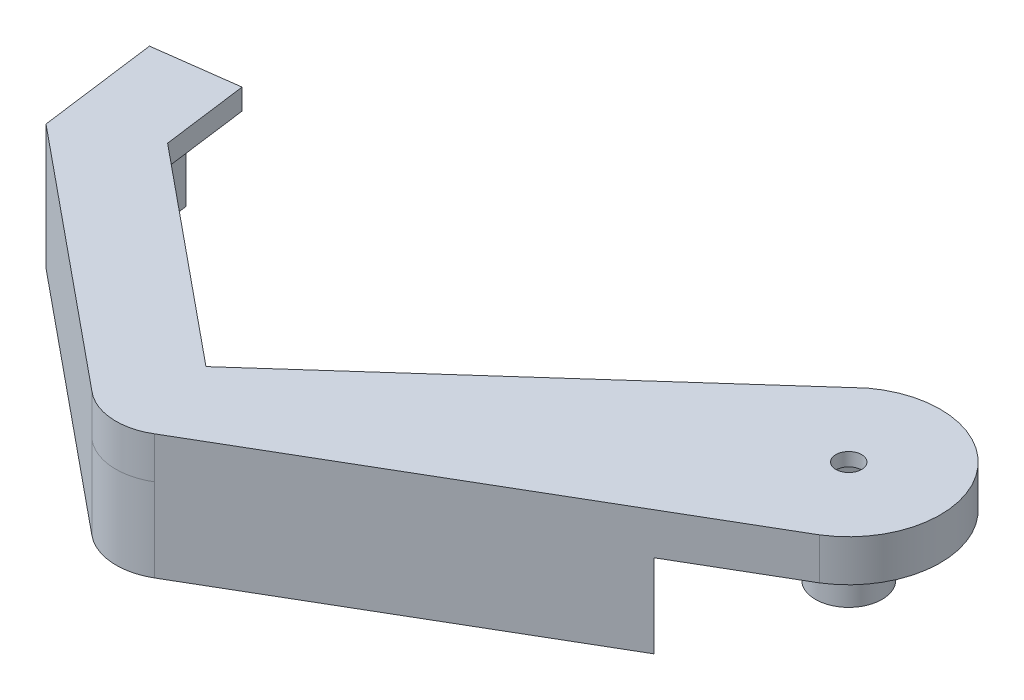
from build123d import *

# Parameters (mm, degrees)
SKETCH1_R           = 10.33488188
BOSS_EXTRUDE1_DEPTH = 4
MOVE_FACE1_BY       = 3
BOSS_EXTRUDE3_DEPTH = 5
SKETCH6_R           = 6.3
BOSS_EXTRUDE4_DEPTH = 0.3
MOVE_FACE2_BY       = 1
BOSS_EXTRUDE5_DEPTH = 10
CUT_EXTRUDE3_START  = -2.5
CUT_EXTRUDE3_DEPTH  = 2.5
SKETCH11_W          = 38.556462408
SKETCH11_H          = 5
CUT_EXTRUDE4_DEPTH  = 22
SKETCH13_R          = 4
BOSS_EXTRUDE6_DEPTH = 7
SKETCH14_R          = 1.55
CUT_EXTRUDE6_DEPTH  = 14.3
CUT_EXTRUDE7_DEPTH  = 2.5
SKETCH17_W          = 30.64904457
SKETCH17_H          = 15.626875577
CUT_REVOLVE1_ANGLE  = 270


with BuildPart() as part:
    # Sketch1 → Boss-Extrude1 (new body)
    with BuildSketch(Plane(origin=(0, 0, 0), x_dir=(1, 0, 0), z_dir=(0, 1, 0))):
        Circle(SKETCH1_R)
    extrude(amount=BOSS_EXTRUDE1_DEPTH)

    # Move Face1: a face moved inward by 3.0
    extrude(part.faces().sort_by_distance((0, 0, 0))[0], amount=MOVE_FACE1_BY, dir=(0, 1, 0), mode=Mode.SUBTRACT)

    # Sketch5 → Boss-Extrude3 (add)
    with BuildSketch(Plane.XZ.offset(-3)):
        with BuildLine():
            Line((-75.458239849, -2.567544533), (-74.096914155, 7.742973997))
            Line((-74.096914155, 7.742973997), (-48.544654941, 28.683445601))
            Line((-48.544654941, 28.683445601), (-6.542555498, -8.842791841))
            ThreePointArc((-6.542555498, -8.842791841), (9.276836304, -5.911032751), (5.250823636, 9.665860083))
            Line((5.250823636, 9.665860083), (-44.629402075, 38.762368423))
            ThreePointArc((-44.629402075, 38.762368423), (-48.82752122, 39.760372459), (-52.815565057, 38.112427446))
            Line((-52.815565057, 38.112427446), (-83.396048293, 13.051248491))
            Line((-83.396048293, 13.051248491), (-85.286900385, -1.269839857))
            Line((-85.286900385, -1.269839857), (-75.458239849, -2.567544533))
        make_face()
    extrude(amount=BOSS_EXTRUDE3_DEPTH)

    # Sketch6 → Boss-Extrude4 (add)
    with BuildSketch(Plane.XZ.offset(2)):
        Circle(SKETCH6_R)
    extrude(amount=BOSS_EXTRUDE4_DEPTH)

    # Move Face2: a face moved inward by 1.0
    extrude(part.faces().sort_by_distance((0, 4, 0))[0], amount=MOVE_FACE2_BY, dir=(0, -1, 0), mode=Mode.SUBTRACT)

    # Sketch8 → Boss-Extrude5 (add)
    with BuildSketch(Plane.XZ.offset(2)):
        with BuildLine():
            Line((-85.286900385, -1.269839857), (-81.401644859, -1.782820669))
            Line((-81.401644859, -1.782820669), (-79.667167658, 11.353902903))
            Line((-79.667167658, 11.353902903), (-48.948307508, 36.528483878))
            Line((-48.948307508, 36.528483878), (-12.814011549, 12.57544193))
            ThreePointArc((-12.814011549, 12.57544193), (-9.977104961, 14.926419809), (-6.720020018, 16.648782619))
            Line((-6.720020018, 16.648782619), (-44.629402075, 38.762368423))
            ThreePointArc((-44.629402075, 38.762368423), (-48.824767697, 39.725691179), (-52.815565057, 38.112427446))
            Line((-52.815565057, 38.112427446), (-83.396048293, 13.051248491))
            Line((-83.396048293, 13.051248491), (-85.286900385, -1.269839857))
        make_face()
    extrude(amount=BOSS_EXTRUDE5_DEPTH)

    # Sketch9 → Cut-Extrude3 (cut)
    with BuildSketch(Plane.XZ.offset(2).offset(CUT_EXTRUDE3_START)):
        with BuildLine():
            Line((-17.906010426, 1.309741328), (-75.458239849, -2.567544533))
            Line((-75.458239849, -2.567544533), (-81.401644859, -1.782820669))
            Line((-81.401644859, -1.782820669), (-79.667167658, 11.353902903))
            Line((-79.667167658, 11.353902903), (-48.948307508, 36.528483878))
            Line((-48.948307508, 36.528483878), (-12.814011549, 12.57544193))
            ThreePointArc((-12.814011549, 12.57544193), (-16.360285451, 7.394707004), (-17.906010426, 1.309741328))
        make_face()
    extrude(amount=CUT_EXTRUDE3_DEPTH, mode=Mode.SUBTRACT)

    # Sketch10 → Revolve3 (revolve)
    with BuildSketch(Plane(origin=(0, 0, 0), x_dir=(-0.8335005239033985, 0, 0.5525186663387585), z_dir=(-0.5525186663387585, 0, -0.8335005239033985))):
        with BuildLine():
            Line((17.953847268, 1.010036729), (20.953847268, 1.010036729))
            ThreePointArc((20.953847268, 1.010036729), (20.075167612, -1.111283615), (17.953847268, -1.989963271))
            Line((17.953847268, -1.989963271), (17.953847268, 1.010036729))
        make_face()
    revolve(axis=Axis((0, -2, 0), (0, 1, 0)))

    # Sketch11 → Cut-Extrude4 (cut)
    with BuildSketch(Plane(origin=(-7.297700024, 0, -8.168117643), x_dir=(-0.7457227293695607, 0, 0.6662564152798927), z_dir=(-0.6662564152798927, 0, -0.7457227293695607))):
        with Locations((0.563178153, 0.5)):
            Rectangle(SKETCH11_W, SKETCH11_H)
    extrude(amount=CUT_EXTRUDE4_DEPTH, mode=Mode.SUBTRACT)

    # Sketch13 → Boss-Extrude6 (add)
    with BuildSketch(Plane.XZ.offset(2.3)):
        Circle(SKETCH13_R)
    extrude(amount=BOSS_EXTRUDE6_DEPTH)

    # Sketch14 → Cut-Extrude6 (cut)
    with BuildSketch(Plane.XZ.offset(9.3)):
        Circle(SKETCH14_R)
    extrude(amount=-CUT_EXTRUDE6_DEPTH, mode=Mode.SUBTRACT)

    # Sketch15 → Cut-Extrude7 (cut)
    with BuildSketch(Plane(origin=(0, -1.1, 0), x_dir=(-1, 0, 0), z_dir=(0, -1, 0))):
        Polygon((2.070374006, -2.777328118), (3.440423708, 0.404332426), (1.370049701, 3.181660544), (-2.070374006, 2.777328118), (-3.440423708, -0.404332426), (-1.370049701, -3.181660544), align=None)
    extrude(amount=-CUT_EXTRUDE7_DEPTH, mode=Mode.SUBTRACT)

    # Sketch17 → Cut-Revolve1 (revolve, cut)
    with BuildSketch(Plane(origin=(5.539973034, 0, 9.497191282), x_dir=(0.8637810865498178, 0, -0.5038672786744701), z_dir=(0.5038672786744701, 0, 0.8637810865498178))):
        with Locations((-4.089761175, -0.448773701)):
            Rectangle(SKETCH17_W, SKETCH17_H)
    revolve(axis=Axis((15.244347193, -8.26221149, 3.836362775), (0, 1, 0)), revolution_arc=CUT_REVOLVE1_ANGLE, mode=Mode.SUBTRACT)


solid = part.part
